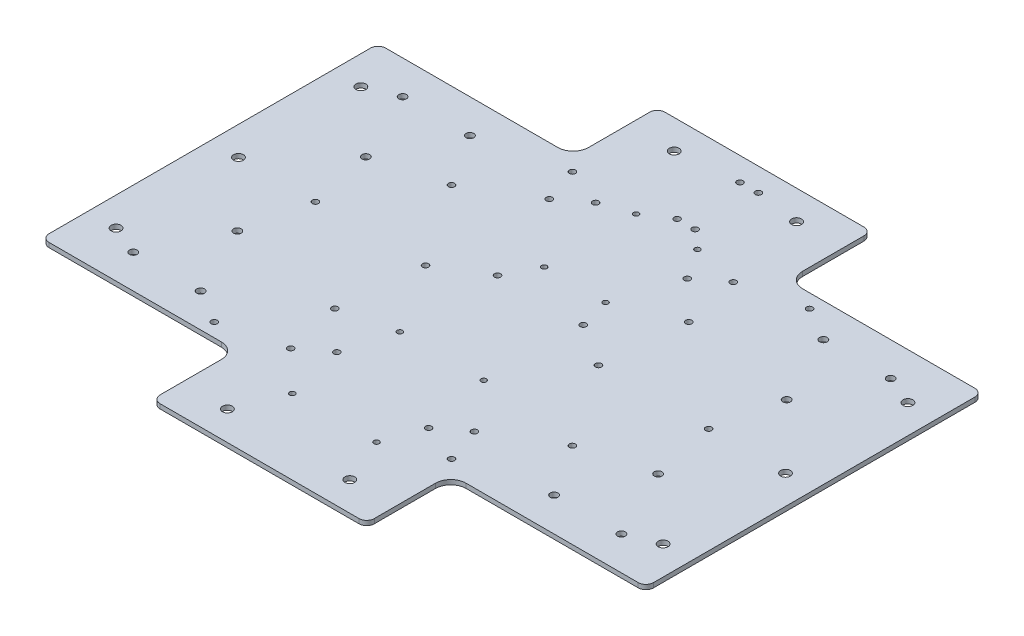
from build123d import *

# Parameters (mm, degrees)
SKETCH_1_R          = 2.5
SKETCH_1_R_2        = 3.2
EXTRUDE_1_DEPTH     = 3
SKETCH_2_R          = 2
SKETCH_2_R_2        = 1.75
CUT_EXTRUDE_1_DEPTH = 10


with BuildPart() as part:
    # Эскиз1 → Бобышка-Вытянуть1 (new body)
    with BuildSketch(Plane(origin=(0, 0, 0), x_dir=(1, 0, 0), z_dir=(0, 1, 0))):
        with BuildLine():
            ThreePointArc((-70, -160), (-68.535533906, -163.535533906), (-65, -165))
            Line((-65, -165), (65, -165))
            ThreePointArc((65, -165), (68.535533906, -163.535533906), (70, -160))
            Line((70, -160), (70, -120))
            ThreePointArc((70, -120), (72.928932188, -112.928932188), (80, -110))
            Line((80, -110), (134.901841239, -110))
            Line((134.901841239, -110), (160.901841239, -110))
            Line((160.901841239, -110), (192.5, -110))
            ThreePointArc((192.5, -110), (196.035533906, -108.535533906), (197.5, -105))
            Line((197.5, -105), (197.5, 105))
            ThreePointArc((197.5, 105), (196.035533906, 108.535533906), (192.5, 110))
            Line((192.5, 110), (160.901841239, 110))
            Line((160.901841239, 110), (134.901841239, 110))
            Line((134.901841239, 110), (80, 110))
            ThreePointArc((80, 110), (72.928932188, 112.928932188), (70, 120))
            Line((70, 120), (70, 160))
            ThreePointArc((70, 160), (68.535533906, 163.535533906), (65, 165))
            Line((65, 165), (-65, 165))
            ThreePointArc((-65, 165), (-68.535533906, 163.535533906), (-70, 160))
            Line((-70, 160), (-70, 120))
            ThreePointArc((-70, 120), (-72.928932188, 112.928932188), (-80, 110))
            Line((-80, 110), (-134.901841239, 110))
            Line((-134.901841239, 110), (-160.901841239, 110))
            Line((-160.901841239, 110), (-192.5, 110))
            ThreePointArc((-192.5, 110), (-196.035533906, 108.535533906), (-197.5, 105))
            Line((-197.5, 105), (-197.5, -105))
            ThreePointArc((-197.5, -105), (-196.035533906, -108.535533906), (-192.5, -110))
            Line((-192.5, -110), (-80, -110))
            ThreePointArc((-80, -110), (-72.928932188, -112.928932188), (-70, -120))
            Line((-70, -120), (-70, -160))
        make_face()
        with Locations((-159.5, -88)):
            Circle(SKETCH_1_R, mode=Mode.SUBTRACT)
        with Locations((-115.5, -88)):
            Circle(SKETCH_1_R, mode=Mode.SUBTRACT)
        with Locations((-40, -146)):
            Circle(SKETCH_1_R_2, mode=Mode.SUBTRACT)
        with Locations((-178.768667216, -80)):
            Circle(SKETCH_1_R_2, mode=Mode.SUBTRACT)
        with Locations((-137.5, -42)):
            Circle(SKETCH_1_R, mode=Mode.SUBTRACT)
        with Locations((40, -146)):
            Circle(SKETCH_1_R_2, mode=Mode.SUBTRACT)
        with Locations((115.5, -88)):
            Circle(SKETCH_1_R, mode=Mode.SUBTRACT)
        with Locations((159.5, -88)):
            Circle(SKETCH_1_R, mode=Mode.SUBTRACT)
        with Locations((137.5, -42)):
            Circle(SKETCH_1_R, mode=Mode.SUBTRACT)
        with Locations((178.768667216, -80)):
            Circle(SKETCH_1_R_2, mode=Mode.SUBTRACT)
        with Locations((-178.768667216, 0)):
            Circle(SKETCH_1_R_2, mode=Mode.SUBTRACT)
        with Locations((-178.768667216, 80)):
            Circle(SKETCH_1_R_2, mode=Mode.SUBTRACT)
        with Locations((-137.5, 42)):
            Circle(SKETCH_1_R, mode=Mode.SUBTRACT)
        with Locations((-159.5, 88)):
            Circle(SKETCH_1_R, mode=Mode.SUBTRACT)
        with Locations((-115.5, 88)):
            Circle(SKETCH_1_R, mode=Mode.SUBTRACT)
        with Locations((-40, 146)):
            Circle(SKETCH_1_R_2, mode=Mode.SUBTRACT)
        with Locations((178.768667216, 0)):
            Circle(SKETCH_1_R_2, mode=Mode.SUBTRACT)
        with Locations((137.5, 42)):
            Circle(SKETCH_1_R, mode=Mode.SUBTRACT)
        with Locations((178.768667216, 80)):
            Circle(SKETCH_1_R_2, mode=Mode.SUBTRACT)
        with Locations((40, 146)):
            Circle(SKETCH_1_R_2, mode=Mode.SUBTRACT)
        with Locations((115.5, 88)):
            Circle(SKETCH_1_R, mode=Mode.SUBTRACT)
        with Locations((159.5, 88)):
            Circle(SKETCH_1_R, mode=Mode.SUBTRACT)
    extrude(amount=EXTRUDE_1_DEPTH)

    # Эскиз2 → Вырез-Вытянуть1 (cut)
    with BuildSketch(Plane(origin=(0, 3, 0), x_dir=(1, 0, 0), z_dir=(0, 1, 0))):
        with Locations((128.5, 0)):
            Circle(SKETCH_2_R)
        with Locations((56.5, 0)):
            Circle(SKETCH_2_R)
        with Locations((93.5, 101)):
            Circle(SKETCH_2_R)
        with Locations((61.5, 54)):
            Circle(SKETCH_2_R)
        with Locations((53.5, 91.092247848)):
            Circle(SKETCH_2_R)
        with Locations((36.502982491, 78.046799413)):
            Circle(SKETCH_2_R)
        with Locations((28.680928288, 17.871923503)):
            Circle(SKETCH_2_R)
        with Locations((-27.319071712, 17.871923503)):
            Circle(SKETCH_2_R)
        with Locations((27.496289721, -46.022287392)):
            Circle(SKETCH_2_R_2)
        with Locations((93.5, -54.053341302)):
            Circle(SKETCH_2_R)
        with Locations((61.5, -101.042998556)):
            Circle(SKETCH_2_R)
        with Locations((53.5, -78.07249598)):
            Circle(SKETCH_2_R)
        with Locations((36.502982491, -90.999139468)):
            Circle(SKETCH_2_R)
        with Locations((27.496289721, -116.033195429)):
            Circle(SKETCH_2_R_2)
        with Locations((-27.552622159, -116.033195429)):
            Circle(SKETCH_2_R_2)
        with Locations((-27.319071712, -46)):
            Circle(SKETCH_2_R_2)
        with Locations((-53.636340651, -90.999139468)):
            Circle(SKETCH_2_R)
        with Locations((-36.401722668, -78.07249598)):
            Circle(SKETCH_2_R)
        with Locations((-93.526794479, -101.042998556)):
            Circle(SKETCH_2_R)
        with Locations((-61.727710595, -54.053341302)):
            Circle(SKETCH_2_R)
        with Locations((-36.401722668, 91.092247848)):
            Circle(SKETCH_2_R)
        with Locations((-53.636340651, 78.046799413)):
            Circle(SKETCH_2_R)
        with Locations((-61.541675198, 101)):
            Circle(SKETCH_2_R)
        with Locations((-93.526794479, 54)):
            Circle(SKETCH_2_R)
        with Locations((-128.5, 0)):
            Circle(SKETCH_2_R)
        with Locations((-56.5, 0)):
            Circle(SKETCH_2_R)
        with Locations((-16.832308482, 37.872518528)):
            Circle(SKETCH_2_R_2)
        with Locations((-16.797794126, 97.927570988)):
            Circle(SKETCH_2_R_2)
        with Locations((23.276008527, 97.927570988)):
            Circle(SKETCH_2_R_2)
        with Locations((23.276008527, 37.872518528)):
            Circle(SKETCH_2_R_2)
        with Locations((-0.75963633, 149.730797231)):
            Circle(SKETCH_2_R)
        with Locations((11.137406716, 149.864440097)):
            Circle(SKETCH_2_R)
        with Locations((11.137406716, 108.512875125)):
            Circle(SKETCH_2_R)
        with Locations((-0.627896327, 108.512875125)):
            Circle(SKETCH_2_R)
    extrude(amount=-CUT_EXTRUDE_1_DEPTH, mode=Mode.SUBTRACT)


solid = part.part
